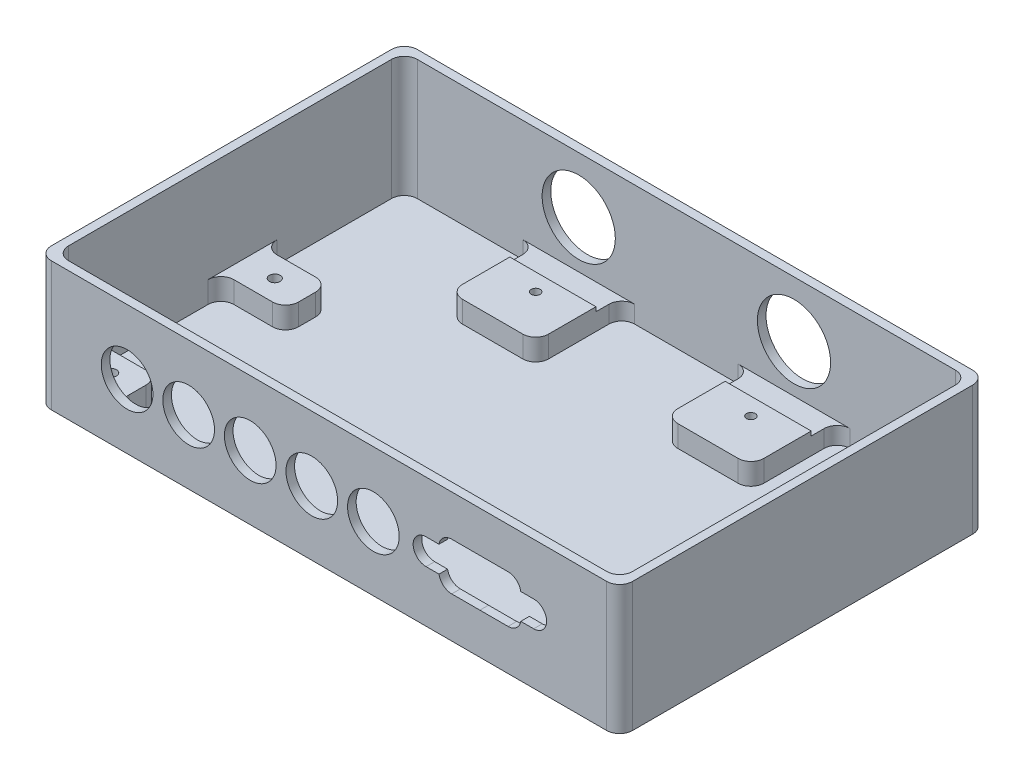
from build123d import *

# Parameters (mm, degrees)
SKIZZE1_W                       = 135
SKIZZE1_H                       = 85
AUFSATZ_LINEAR_AUSTRAGEN1_DEPTH = 30
SCHALE1_T                       = -2
SKIZZE2_R                       = 6
SCHNITT_LINEAR_AUSTRAGEN1_DEPTH = 30
SCHNITT_LINEAR_AUSTRAGEN2_DEPTH = 10
VERRUNDUNG1_R                   = 3
AUFSATZ_LINEAR_AUSTRAGEN2_DEPTH = 5
VERRUNDUNG2_R                   = 3
SKIZZE5_W                       = 15
SKIZZE5_H                       = 10
AUFSATZ_LINEAR_AUSTRAGEN3_DEPTH = 5
VERRUNDUNG3_R                   = 3
SKIZZE6_R                       = 8.5
SCHNITT_LINEAR_AUSTRAGEN3_DEPTH = 5
SKIZZE7_W                       = 20
SKIZZE7_H                       = 20
AUFSATZ_LINEAR_AUSTRAGEN4_DEPTH = 5
VERRUNDUNG4_R                   = 3
M3_GEWINDEBOHRUNG1_D            = 2.5
M3_GEWINDEBOHRUNG1_DEPTH        = 8.5
M3_GEWINDEBOHRUNG1_TIP          = 0.751075774
M2_5_GEWINDEBOHRUNG1_D          = 2.05
M2_5_GEWINDEBOHRUNG1_DEPTH      = 7.25
M2_5_GEWINDEBOHRUNG1_TIP        = 0.615882135
SKIZZE12_W                      = 85
SKIZZE12_H                      = 6
SCHNITT_LINEAR_AUSTRAGEN4_DEPTH = 1


with BuildPart() as part:
    # Skizze1 → Aufsatz-Linear austragen1 (new body)
    with BuildSketch(Plane(origin=(0, 0, 0), x_dir=(1, 0, 0), z_dir=(0, 1, 0))):
        with Locations((67.5, 42.5)):
            Rectangle(SKIZZE1_W, SKIZZE1_H)
    extrude(amount=AUFSATZ_LINEAR_AUSTRAGEN1_DEPTH)

    # Schale1
    schale1_openings = [part.faces().sort_by_distance(p)[0] for p in [
        (67.5, 30, -42.5),
    ]]
    offset(amount=SCHALE1_T, openings=schale1_openings, kind=Kind.INTERSECTION)

    # Skizze2 → Schnitt-Linear austragen1 (cut)
    with BuildSketch(Plane.XY):
        with Locations((20.6, 14.94)):
            Circle(SKIZZE2_R)
        with Locations((34.9, 14.94)):
            Circle(SKIZZE2_R)
        with Locations((49.2, 14.94)):
            Circle(SKIZZE2_R)
        with Locations((63.5, 14.94)):
            Circle(SKIZZE2_R)
        with Locations((77.8, 14.94)):
            Circle(SKIZZE2_R)
    extrude(amount=-SCHNITT_LINEAR_AUSTRAGEN1_DEPTH, mode=Mode.SUBTRACT)

    # Skizze3 → Schnitt-Linear austragen2 (cut)
    with BuildSketch(Plane.XY):
        with BuildLine():
            Line((109.082181292, 20.48963825), (102.54015207, 20.49))
            Line((102.54015207, 20.49), (95.998122837, 20.49))
            ThreePointArc((95.998122837, 20.49), (94.061631164, 19.781287847), (93.040082946, 17.99))
            Line((93.040082946, 17.99), (90.04, 17.99))
            ThreePointArc((90.04, 17.99), (87.04, 14.99), (90.04, 11.99))
            Line((90.04, 11.99), (93.040082946, 11.99))
            ThreePointArc((93.040082946, 11.99), (94.061631164, 10.198712153), (95.998122837, 9.49))
            Line((95.998122837, 9.49), (102.53954381, 9.49))
            Line((102.53954381, 9.49), (102.54015207, 9.49))
            Line((102.54015207, 9.489999983), (109.081573032, 9.489638266))
            ThreePointArc((109.081573032, 9.489638266), (111.018103892, 10.198243337), (112.03975116, 11.989474694))
            Line((112.03975116, 11.989474694), (115.039834101, 11.9893088))
            ThreePointArc((115.039834101, 11.9893088), (118.039999986, 14.989142906), (115.04016588, 17.989308791))
            Line((115.04016588, 17.989308791), (112.040082938, 17.989474685))
            ThreePointArc((112.040082938, 17.989474685), (111.018633773, 19.780819017), (109.082181292, 20.48963825))
        make_face()
    extrude(amount=-SCHNITT_LINEAR_AUSTRAGEN2_DEPTH, mode=Mode.SUBTRACT)

    # Verrundung1
    verrundung1_edges = [part.edges().sort_by_distance(p)[0] for p in [
        (0, 15, -85),
        (135, 15, -85),
        (135, 15, 0),
        (0, 15, 0),
        (133, 16, -2),
        (133, 16, -83),
        (2, 16, -83),
        (2, 16, -2),
    ]]
    fillet(verrundung1_edges, radius=VERRUNDUNG1_R)

    # Skizze4 → Aufsatz-Linear austragen2 (add)
    with BuildSketch(Plane(origin=(0, 2, 0), x_dir=(1, 0, 0), z_dir=(0, 1, 0))):
        with BuildLine():
            Line((119, 9), (119, 2))
            Line((119, 2), (130, 2))
            ThreePointArc((130, 2), (132.121320344, 2.878679656), (133, 5))
            Line((133, 5), (133, 12))
            Line((133, 12), (122, 12))
            ThreePointArc((122, 12), (119.878679656, 11.121320344), (119, 9))
        make_face()
        with BuildLine():
            Line((13, 12), (2, 12))
            Line((2, 12), (2, 5))
            ThreePointArc((2, 5), (2.878679656, 2.878679656), (5, 2))
            Line((5, 2), (16, 2))
            Line((16, 2), (16, 9))
            ThreePointArc((16, 9), (15.121320344, 11.121320344), (13, 12))
        make_face()
    extrude(amount=AUFSATZ_LINEAR_AUSTRAGEN2_DEPTH)

    # Verrundung2
    verrundung2_edges = [part.edges().sort_by_distance(p)[0] for p in [
        (133, 4.5, -12),
        (119, 4.5, -2),
        (16, 4.5, -2),
        (2, 4.5, -12),
    ]]
    fillet(verrundung2_edges, radius=VERRUNDUNG2_R)

    # Skizze5 → Aufsatz-Linear austragen3 (add)
    with BuildSketch(Plane(origin=(0, 2, 0), x_dir=(1, 0, 0), z_dir=(0, 1, 0))):
        with Locations((9.5, 45.4)):
            Rectangle(SKIZZE5_W, SKIZZE5_H)
        with Locations((125.5, 45.4)):
            Rectangle(SKIZZE5_W, SKIZZE5_H)
    extrude(amount=AUFSATZ_LINEAR_AUSTRAGEN3_DEPTH)

    # Verrundung3
    verrundung3_edges = [part.edges().sort_by_distance(p)[0] for p in [
        (133, 4.5, -40.4),
        (133, 4.5, -50.4),
        (118, 4.5, -40.4),
        (118, 4.5, -50.4),
        (2, 4.5, -50.4),
        (17, 4.5, -50.4),
        (17, 4.5, -40.4),
        (2, 4.5, -40.4),
    ]]
    fillet(verrundung3_edges, radius=VERRUNDUNG3_R)

    # Skizze6 → Schnitt-Linear austragen3 (cut)
    with BuildSketch(Plane(origin=(0, 0, -85), x_dir=(-1, 0, 0), z_dir=(0, 0, -1))):
        with Locations((-92.5, 17)):
            Circle(SKIZZE6_R)
        with Locations((-42.5, 17)):
            Circle(SKIZZE6_R)
    extrude(amount=-SCHNITT_LINEAR_AUSTRAGEN3_DEPTH, mode=Mode.SUBTRACT)

    # Skizze7 → Aufsatz-Linear austragen4 (add)
    with BuildSketch(Plane(origin=(0, 2, 0), x_dir=(1, 0, 0), z_dir=(0, 1, 0))):
        with Locations((42.5, 73)):
            Rectangle(SKIZZE7_W, SKIZZE7_H)
        with Locations((92.5, 73)):
            Rectangle(SKIZZE7_W, SKIZZE7_H)
    extrude(amount=AUFSATZ_LINEAR_AUSTRAGEN4_DEPTH)

    # Verrundung4
    verrundung4_edges = [part.edges().sort_by_distance(p)[0] for p in [
        (102.5, 4.5, -83),
        (102.5, 4.5, -63),
        (82.5, 4.5, -63),
        (82.5, 4.5, -83),
        (32.5, 4.5, -83),
        (32.5, 4.5, -63),
        (52.5, 4.5, -83),
        (52.5, 4.5, -63),
    ]]
    fillet(verrundung4_edges, radius=VERRUNDUNG4_R)

    # M3 Gewindebohrung1
    with Locations(Plane(origin=(0, 7, 0), x_dir=(1, 0, 0), z_dir=(0, 1, 0))):
        with Locations((125.5, 7.4), (9.5, 45.4), (125.5, 45.4), (9.5, 7.4)):
            Hole(M3_GEWINDEBOHRUNG1_D / 2, depth=M3_GEWINDEBOHRUNG1_DEPTH)
            with Locations((0, 0, -(M3_GEWINDEBOHRUNG1_DEPTH + M3_GEWINDEBOHRUNG1_TIP / 2))):  # 118° drill point
                Cone(0, M3_GEWINDEBOHRUNG1_D / 2, M3_GEWINDEBOHRUNG1_TIP, mode=Mode.SUBTRACT)

    # M2.5 Gewindebohrung1
    with Locations(Plane(origin=(0, 7, 0), x_dir=(1, 0, 0), z_dir=(0, 1, 0))):
        with Locations((42.5, 73), (92.5, 73)):
            Hole(M2_5_GEWINDEBOHRUNG1_D / 2, depth=M2_5_GEWINDEBOHRUNG1_DEPTH)
            with Locations((0, 0, -(M2_5_GEWINDEBOHRUNG1_DEPTH + M2_5_GEWINDEBOHRUNG1_TIP / 2))):  # 118° drill point
                Cone(0, M2_5_GEWINDEBOHRUNG1_D / 2, M2_5_GEWINDEBOHRUNG1_TIP, mode=Mode.SUBTRACT)

    # Skizze12 → Schnitt-Linear austragen4 (cut)
    with BuildSketch(Plane(origin=(0, 7, 0), x_dir=(1, 0, 0), z_dir=(0, 1, 0))):
        with Locations((66.348936769, 80)):
            Rectangle(SKIZZE12_W, SKIZZE12_H)
    extrude(amount=-SCHNITT_LINEAR_AUSTRAGEN4_DEPTH, mode=Mode.SUBTRACT)


solid = part.part
